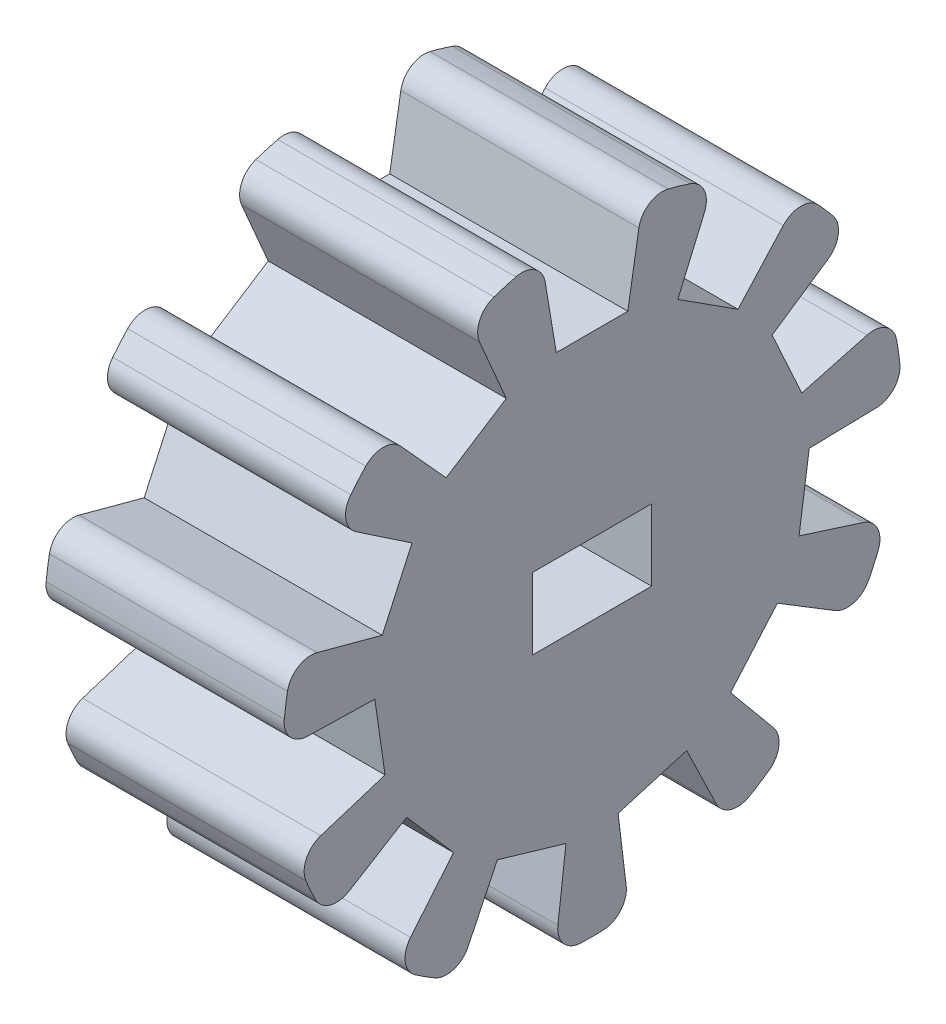
from build123d import *

# Parameters (mm, degrees)
SKETCH1_W                = 10
SKETCH1_H                = 13
CUT_EXTRUDE1_DEPTH       = 10
SKETCH7_W                = 5
SKETCH7_H                = 3
CUT_EXTRUDE2_DEPTH       = 10
FILLET1_R                = 1
CIRPATTERN1_COUNT        = 11
FILLET1_OF_CIRPATTERN1_R = 1


with BuildPart() as part:
    # Sketch1 → Revolve1 (revolve)
    with BuildSketch(Plane.XY):
        with Locations((-5, 6.5)):
            Rectangle(SKETCH1_W, SKETCH1_H)
    revolve(axis=Axis((-10, 0, 0), (-1, 0, 0)))

    # Sketch6 → Cut-Extrude1 (cut)
    with BuildSketch(Plane(origin=(0, 0, 0), x_dir=(0, 0, -1), z_dir=(1, 0, 0))):
        Polygon((-1.501758676, 9), (1.501758676, 9), (2.502016427, 15), (-2.502016427, 15), align=None)
    cut_extrude1 = extrude(amount=-CUT_EXTRUDE1_DEPTH, mode=Mode.SUBTRACT)

    # Sketch7 → Cut-Extrude2 (cut)
    with BuildSketch(Plane(origin=(0, 0, 0), x_dir=(0, 0, -1), z_dir=(1, 0, 0))):
        Rectangle(SKETCH7_W, SKETCH7_H)
    extrude(amount=-CUT_EXTRUDE2_DEPTH, mode=Mode.SUBTRACT)

    # Fillet1
    fillet1_edges = [part.edges().sort_by_distance(p)[0] for p in [
        (-5, 12.822809052, -2.13905774),
        (-5, 12.822809052, 2.13905774),
    ]]
    fillet(fillet1_edges, radius=FILLET1_R)

    # CirPattern1: Cut-Extrude1 ×11 about axis
    cirpattern1_axis = Axis((-10, 0, 0), (1, 0, 0))
    for i in range(1, CIRPATTERN1_COUNT):
        add(cut_extrude1.rotate(cirpattern1_axis, i * 360 / CIRPATTERN1_COUNT), mode=Mode.SUBTRACT)

    # Fillet1 of CirPattern1
    fillet1_of_cirpattern1_edges = [part.edges().sort_by_distance(p)[0] for p in [
        (-5, 11.943695341, 5.133044087),
        (-5, 9.630771491, 8.732023849),
        (-5, 7.27254275, 10.775440685),
        (-5, 3.381032029, 12.552634083),
        (-5, 0.29240922, 12.996711001),
        (-5, -3.942161213, 12.387871688),
        (-5, -6.78056217, 11.091617405),
        (-5, -10.013746124, 8.290047561),
        (-5, -11.700752981, 5.665013652),
        (-5, -12.906037394, 1.560191908),
        (-5, -12.906037394, -1.560191908),
        (-5, -11.700752981, -5.665013652),
        (-5, -10.013746124, -8.290047561),
        (-5, -6.78056217, -11.091617405),
        (-5, -3.942161213, -12.387871688),
        (-5, 0.29240922, -12.996711001),
        (-5, 3.381032029, -12.552634083),
        (-5, 7.27254275, -10.775440685),
        (-5, 9.630771491, -8.732023849),
        (-5, 11.943695341, -5.133044087),
    ]]
    fillet(fillet1_of_cirpattern1_edges, radius=FILLET1_OF_CIRPATTERN1_R)


solid = part.part
